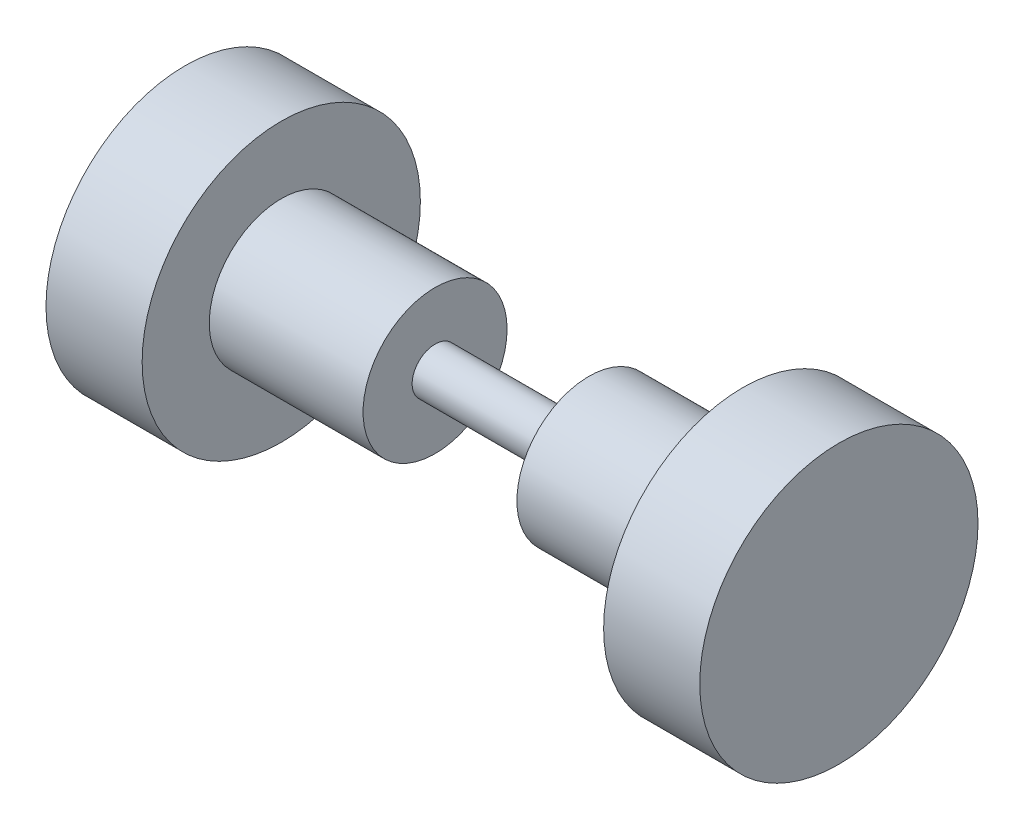
from build123d import *


with BuildPart() as part:
    # Sketch1 → Revolve1 (revolve)
    with BuildSketch(Plane(origin=(0, 0, 0), x_dir=(1, 0, 0), z_dir=(0, 1, 0))):
        Polygon((-6.096, 1.902408163), (-2.032, 1.902408163), (-2.032, 0.606489796), (2.032, 0.606489796), (2.032, 1.902408163), (6.096, 1.902408163), (6.096, 3.67522449), (8.636, 3.67522449), (8.636, 0), (-8.636, 0), (-8.636, 3.67522449), (-6.096, 3.67522449), align=None)
    revolve(axis=Axis((8.636, 0, 0), (-1, 0, 0)))


solid = part.part
